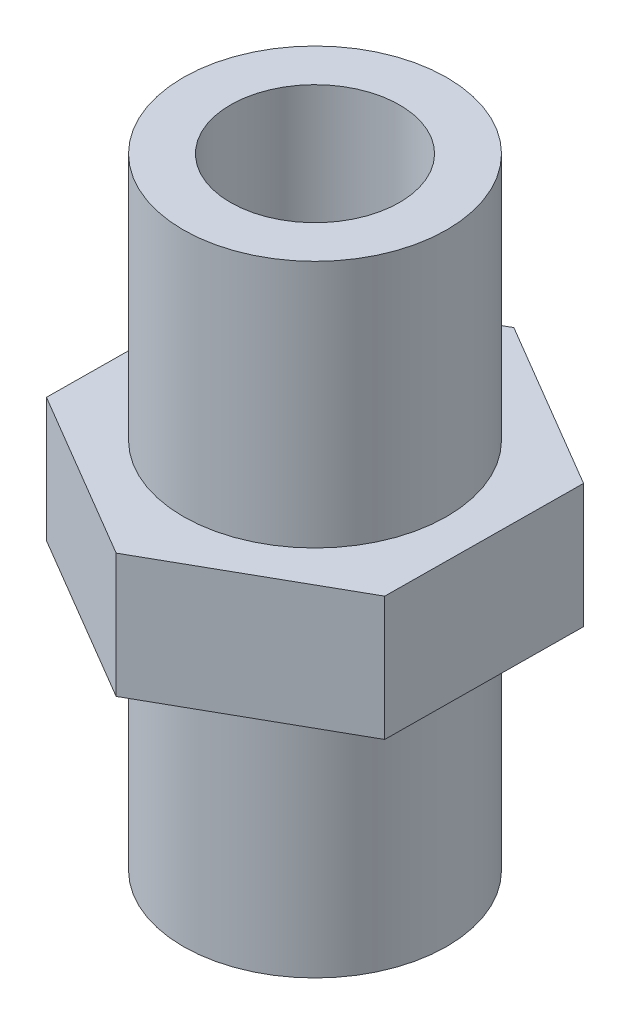
from build123d import *

# Parameters (mm, degrees)
SKETCH1_R               = 8.5
BOSS_EXTRUDE1_DEPTH     = 20
BOSS_EXTRUDE2_DEPTH     = 4
CUT_EXTRUDE1_DEPTH      = 44.400071981
CUT_EXTRUDE1_DEPTH_BACK = 44.400071981
SKETCH3_R               = 5.45
FILLET1_R               = 6


with BuildPart() as part:
    # Sketch1 → Boss-Extrude1 (new, symmetric)
    with BuildSketch(Plane(origin=(0, 0, 0), x_dir=(1, 0, 0), z_dir=(0, 1, 0))):
        with Locations(Location((0, 0, 0), (0, 0, 270))):
            Circle(SKETCH1_R)
    extrude(amount=BOSS_EXTRUDE1_DEPTH, both=True)

    # Sketch2 → Boss-Extrude2 (add, symmetric)
    with BuildSketch(Plane(origin=(0, 0, 0), x_dir=(1, 0, 0), z_dir=(0, 1, 0))):
        Polygon((11.056485774, 6.251996134), (0.113855411, 12.701195624), (-10.942630364, 6.44919949), (-11.056485774, -6.251996134), (-0.113855411, -12.701195624), (10.942630364, -6.44919949), align=None)
    extrude(amount=BOSS_EXTRUDE2_DEPTH, both=True)

    # Sketch3 → Cut-Extrude1 (cut, two sides: drawn at the far end of the back side and taken through both)
    with BuildSketch(Plane(origin=(0, 20, 0), x_dir=(1, 0, 0), z_dir=(0, 1, 0)).offset(-CUT_EXTRUDE1_DEPTH_BACK)):
        with Locations(Location((0, 0, 0), (0, 0, 270))):
            Circle(SKETCH3_R)
    extrude(amount=CUT_EXTRUDE1_DEPTH + CUT_EXTRUDE1_DEPTH_BACK, mode=Mode.SUBTRACT)

    # Fillet1
    # the kernel refuses this fillet: 6 mm, written as the material it takes off along each edge
    with BuildSketch(Plane(origin=(0, -20, 0), x_dir=(0, 0, 1), z_dir=(-1, 0, 0))) as fillet1_piece_1:
        with BuildLine():
            CenterArc((11.45, 5.224700948), FILLET1_R, 180, 60.549814279)
            Line((5.45, 5.224700948), (5.33, 5.224700948))
            Line((5.33, 5.224700948), (5.33, 0))
            Line((5.33, 0), (5.45, -0.12))
            ThreePointArc((5.45, -0.12), (6.975, -0.12), (8.441, -0.104494019))
            Line((8.441, -0.104494019), (8.5, 0))
        make_face()
    revolve(axis=Axis((0, -20, 0), (0, 1, 0)), mode=Mode.SUBTRACT)


solid = part.part
